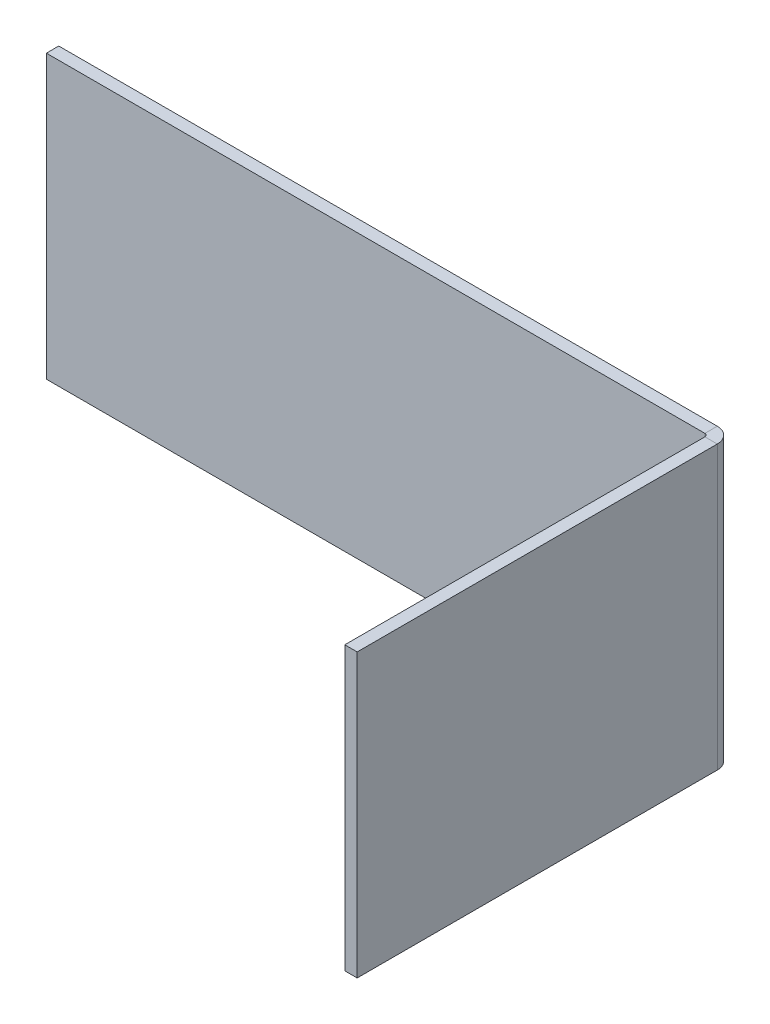
from build123d import *

# Parameters (mm, degrees)
SKETCH2_W          = 159.574581504
SKETCH2_H          = 68.426848692
BASE_FLANGE1_DEPTH = 3
EDGE_FLANGE1_DEPTH = 68.426848692


# Sheet-metal steps are written as plain solids
with BuildPart() as part:
    # Sketch2 → Base-Flange1 (new body)
    with BuildSketch(Plane.XY):
        Rectangle(SKETCH2_W, SKETCH2_H)
    extrude(amount=-BASE_FLANGE1_DEPTH)

    # Edge-Flange1 section (across the edge) → Edge-Flange1 (add)
    with BuildSketch(Plane(origin=(80.523890752, -34.213424346, 0), x_dir=(-1, 0, 0), z_dir=(0, 1, 0))):
        with BuildLine():
            Line((-3, 0.7366), (-3, 88))
            Line((-3, 88), (0, 88))
            Line((0, 88), (0, 0.7366))
            ThreePointArc((0, 0.7366), (0.215745145, 0.215745145), (0.7366, 0))
            Line((0.7366, 0), (0.7366, -3))
            ThreePointArc((0.7366, -3), (-1.905575199, -1.905575199), (-3, 0.7366))
        make_face()
    extrude(amount=EDGE_FLANGE1_DEPTH)


solid = part.part
